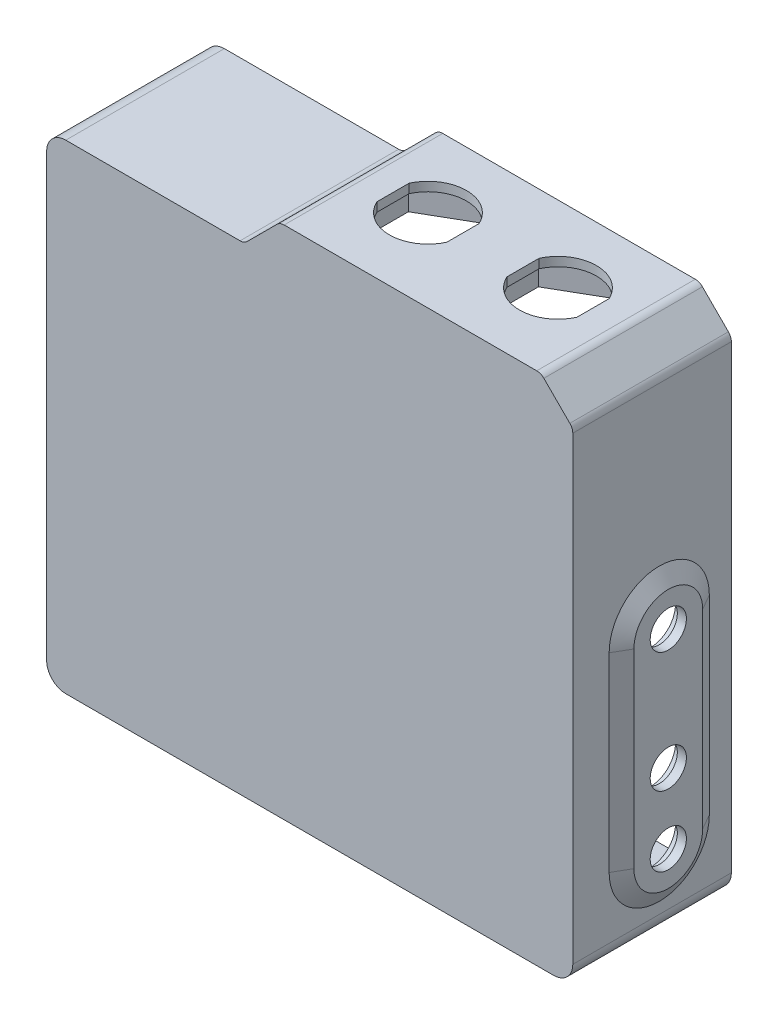
from build123d import *
from OCP.BRepFilletAPI import BRepFilletAPI_MakeChamfer

# Parameters (mm, degrees)
BOSS_EXTRUDE1_DEPTH     = 1.5
BOSS_EXTRUDE2_START     = -1.5
BOSS_EXTRUDE2_DEPTH     = 1.5
FILLET1_R               = 2
BOSS_EXTRUDE3_DEPTH     = 30
SKETCH5_R               = 5.032
SKETCH5_R_2             = 4.832
CUT_EXTRUDE1_DEPTH      = 10
BOSS_EXTRUDE4_START     = 1.8
SKETCH6_R               = 5.032
SKETCH6_R_2             = 3.597
BOSS_EXTRUDE4_DEPTH     = 1.8
CHAMFER1_SIZE           = 3.117691454
CHAMFER1_SIZE_2         = 1.8
CUT_EXTRUDE2_DEPTH      = 11.8
BOSS_EXTRUDE5_OUTLINE_W = 50.173145751
BOSS_EXTRUDE5_OUTLINE_H = 30
BOSS_EXTRUDE5_DEPTH     = 5.3
BOSS_EXTRUDE6_START     = -30
BOSS_EXTRUDE6_DEPTH     = 30
FILLET2_R               = 2
SKETCH10_R              = 2.85
SKETCH10_R_2            = 1.5
BOSS_EXTRUDE7_DEPTH     = 9
CHAMFER2_SIZE           = 2
SKETCH11_R              = 2.85
SKETCH11_R_2            = 1.5
BOSS_EXTRUDE8_DEPTH     = 30
FILLET3_R               = 2


# Read off the part's stored shape, not the designer's step: Boss-Extrude5
# Some blends are built 0.0001 mm under size
with BuildPart() as part:
    # Sketch1 → Boss-Extrude1 (new body)
    with BuildSketch(Plane.XY):
        with BuildLine():
            Line((-71.515147012, 38.673979945), (-31.595147012, 38.673979945))
            Line((-31.595147012, 38.673979945), (25.404852988, 38.673979945))
            ThreePointArc((25.404852988, 38.673979945), (28.091858756, 37.560985714), (29.204852988, 34.873979945))
            Line((29.204852988, 34.873979945), (29.204852988, -31.776020055))
            Line((29.204852988, -31.776020055), (29.204852988, -46.156020055))
            Line((29.204852988, -46.156020055), (29.204852988, -52.766020055))
            ThreePointArc((29.204852988, -52.766020055), (28.091858756, -55.453025824), (25.404852988, -56.566020055))
            Line((25.404852988, -56.566020055), (-31.595147012, -56.566020055))
            Line((-31.595147012, -56.566020055), (-71.515147012, -56.566020055))
            ThreePointArc((-71.515147012, -56.566020055), (-74.202152781, -55.453025824), (-75.315147012, -52.766020055))
            Line((-75.315147012, -52.766020055), (-75.315147012, 34.873979945))
            ThreePointArc((-75.315147012, 34.873979945), (-74.202152781, 37.560985714), (-71.515147012, 38.673979945))
        make_face()
    extrude(amount=BOSS_EXTRUDE1_DEPTH)

    # Sketch2 → Boss-Extrude2 (add)
    with BuildSketch(Plane.XY.offset(1.5).offset(BOSS_EXTRUDE2_START)):
        Polygon((-24.958369356, 43.973979945), (-22.708369356, 43.973979945), (-22.708369356, 45.773979945), (-24.958369356, 45.773979945), (-28.958369356, 45.773979945), (-36.058369356, 38.673979945), (-24.958369356, 38.673979945), (-24.958369356, 41.673979945), align=None)
        Polygon((-22.708369356, 45.773979945), (-22.708369356, 43.973979945), (-24.958369356, 43.973979945), (-24.958369356, 41.673979945), (-24.958369356, 38.673979945), (-6.958369356, 38.673979945), (-6.958369356, 41.673979945), (-6.958369356, 43.973979945), (-9.208369356, 43.973979945), (-9.208369356, 45.773979945), align=None)
        Polygon((-6.958369356, 45.773979945), (-9.208369356, 45.773979945), (-9.208369356, 43.973979945), (-6.958369356, 43.973979945), (-6.958369356, 41.673979945), (-6.958369356, 38.673979945), (0.871630644, 38.673979945), (0.871630644, 41.673979945), (0.871630644, 43.973979945), (3.121630644, 43.973979945), (3.121630644, 45.773979945), (0.871630644, 45.773979945), align=None)
        Polygon((16.621630644, 45.773979945), (3.121630644, 45.773979945), (3.121630644, 43.973979945), (0.871630644, 43.973979945), (0.871630644, 41.673979945), (0.871630644, 38.673979945), (18.871630644, 38.673979945), (18.871630644, 41.673979945), (18.871630644, 43.973979945), (16.621630644, 43.973979945), align=None)
        with BuildLine():
            Line((18.871630644, 45.773979945), (16.621630644, 45.773979945))
            Line((16.621630644, 45.773979945), (16.621630644, 43.973979945))
            Line((16.621630644, 43.973979945), (18.871630644, 43.973979945))
            Line((18.871630644, 43.973979945), (18.871630644, 41.673979945))
            Line((18.871630644, 41.673979945), (18.871630644, 38.673979945))
            Line((18.871630644, 38.673979945), (25.404852988, 38.673979945))
            ThreePointArc((25.404852988, 38.673979945), (28.091858756, 37.560985714), (29.204852988, 34.873979945))
            Line((29.204852988, 34.873979945), (29.204852988, 39.440757601))
            Line((29.204852988, 39.440757601), (22.871630644, 45.773979945))
            Line((22.871630644, 45.773979945), (18.871630644, 45.773979945))
        make_face()
    extrude(amount=BOSS_EXTRUDE2_DEPTH)

    # Fillet1
    fillet1_edges = [part.edges().sort_by_distance(p)[0] for p in [
        (-36.058369356, 38.673979945, 0.75),
        (-28.958369356, 45.773979945, 0.75),
        (22.871630644, 45.773979945, 0.75),
        (29.204852988, 39.440757601, 0.75),
    ]]
    fillet(fillet1_edges, radius=FILLET1_R)

    # Sketch3 → Boss-Extrude3 (add)
    with BuildSketch(Plane(origin=(0, 0, 0), x_dir=(-1, 0, 0), z_dir=(0, 0, -1))):
        with BuildLine():
            Line((-29.204852988, 38.612330476), (-29.204852988, -52.766020055))
            ThreePointArc((-29.204852988, -52.766020055), (-28.091858756, -55.453025824), (-25.404852988, -56.566020055))
            Line((-25.404852988, -56.566020055), (71.515147012, -56.566020055))
            ThreePointArc((71.515147012, -56.566020055), (74.202152781, -55.453025824), (75.315147012, -52.766020055))
            Line((75.315147012, -52.766020055), (75.315147012, 34.873979945))
            ThreePointArc((75.315147012, 34.873979945), (74.202152781, 37.560985714), (71.515147012, 38.673979945))
            Line((71.515147012, 38.673979945), (36.886796481, 38.673979945))
            ThreePointArc((36.886796481, 38.673979945), (36.121429616, 38.82622088), (35.472582919, 39.259766383))
            Line((35.472582919, 39.259766383), (29.544155794, 45.188193507))
            ThreePointArc((29.544155794, 45.188193507), (28.895309096, 45.62173901), (28.129942232, 45.773979945))
            Line((28.129942232, 45.773979945), (-22.043203519, 45.773979945))
            ThreePointArc((-22.043203519, 45.773979945), (-22.808570384, 45.62173901), (-23.457417081, 45.188193507))
            Line((-23.457417081, 45.188193507), (-28.61906655, 40.026544038))
            ThreePointArc((-28.61906655, 40.026544038), (-29.052612053, 39.377697341), (-29.204852988, 38.612330476))
        make_face()
        with BuildLine():
            Line((-25.404852988, -54.766020055), (71.515147012, -54.766020055))
            ThreePointArc((71.515147012, -54.766020055), (72.929360575, -54.180233617), (73.515147012, -52.766020055))
            Line((73.515147012, -52.766020055), (73.515147012, 34.873979945))
            ThreePointArc((73.515147012, 34.873979945), (72.929360575, 36.288193507), (71.515147012, 36.873979945))
            Line((71.515147012, 36.873979945), (36.886796481, 36.873979945))
            ThreePointArc((36.886796481, 36.873979945), (35.432599438, 37.163237721), (34.199790713, 37.986974176))
            Line((34.199790713, 37.986974176), (28.271363588, 43.915401301))
            ThreePointArc((28.271363588, 43.915401301), (28.206478918, 43.958755851), (28.129942232, 43.973979945))
            Line((28.129942232, 43.973979945), (-22.043203519, 43.973979945))
            ThreePointArc((-22.043203519, 43.973979945), (-22.119740205, 43.958755851), (-22.184624875, 43.915401301))
            Line((-22.184624875, 43.915401301), (-27.346274344, 38.753751832))
            ThreePointArc((-27.346274344, 38.753751832), (-27.389628894, 38.688867163), (-27.404852988, 38.612330476))
            Line((-27.404852988, 38.612330476), (-27.404852988, -52.766020055))
            ThreePointArc((-27.404852988, -52.766020055), (-26.81906655, -54.180233617), (-25.404852988, -54.766020055))
        make_face(mode=Mode.SUBTRACT)
    extrude(amount=BOSS_EXTRUDE3_DEPTH)

    # Sketch5 → Cut-Extrude1 (cut)
    # profile 1 of 6: a face of its own
    with BuildSketch(Plane(origin=(29.204852988, 0, 0), x_dir=(0, 0, -1), z_dir=(1, 0, 0))):
        with Locations(Location((15.675, -40.576020055, 0), (0, 0, 90))):
            Circle(SKETCH5_R)
        with Locations((15.675, -40.576020055)):
            Circle(SKETCH5_R_2, mode=Mode.SUBTRACT)
    # profile 2 of 6: a face of its own
    with BuildSketch(Plane(origin=(29.204852988, 0, 0), x_dir=(0, 0, -1), z_dir=(1, 0, 0))):
        with Locations((15.675, -40.576020055)):
            Circle(SKETCH5_R_2)
    # profile 3 of 6: a face of its own
    with BuildSketch(Plane(origin=(29.204852988, 0, 0), x_dir=(0, 0, -1), z_dir=(1, 0, 0))):
        with Locations(Location((15.675, -26.676020055, 0), (0, 0, 90))):
            Circle(SKETCH5_R)
        with Locations((15.675, -26.676020055)):
            Circle(SKETCH5_R_2, mode=Mode.SUBTRACT)
    # profile 4 of 6: a face of its own
    with BuildSketch(Plane(origin=(29.204852988, 0, 0), x_dir=(0, 0, -1), z_dir=(1, 0, 0))):
        with Locations((15.675, -26.676020055)):
            Circle(SKETCH5_R_2)
    # profile 5 of 6: a face of its own
    with BuildSketch(Plane(origin=(29.204852988, 0, 0), x_dir=(0, 0, -1), z_dir=(1, 0, 0))):
        with Locations(Location((15.675, -2.776020055, 0), (0, 0, 90))):
            Circle(SKETCH5_R)
        with Locations((15.675, -2.776020055)):
            Circle(SKETCH5_R_2, mode=Mode.SUBTRACT)
    # profile 6 of 6: a face of its own
    with BuildSketch(Plane(origin=(29.204852988, 0, 0), x_dir=(0, 0, -1), z_dir=(1, 0, 0))):
        with Locations((15.675, -2.776020055)):
            Circle(SKETCH5_R_2)
    extrude(amount=-CUT_EXTRUDE1_DEPTH, mode=Mode.SUBTRACT)

    # Sketch6 → Boss-Extrude4 (add)
    # profile 1 of 4: a face of its own
    with BuildSketch(Plane(origin=(29.204852988, 0, 0), x_dir=(0, 0, -1), z_dir=(1, 0, 0)).offset(BOSS_EXTRUDE4_START)):
        with BuildLine():
            Line((8.843, -40.576020055), (8.843, -2.776020055))
            ThreePointArc((8.843, -2.776020055), (15.675, 4.055979945), (22.507, -2.776020055))
            Line((22.507, -2.776020055), (22.507, -40.576020055))
            ThreePointArc((22.507, -40.576020055), (15.675, -47.408020055), (8.843, -40.576020055))
        make_face()
        with Locations(Location((15.675, -26.676020055, 0), (0, 0, 90))):
            Circle(SKETCH6_R, mode=Mode.SUBTRACT)
        with Locations(Location((15.675, -40.576020055, 0), (0, 0, 90))):
            Circle(SKETCH6_R, mode=Mode.SUBTRACT)
        with Locations(Location((15.675, -2.776020055, 0), (0, 0, 90))):
            Circle(SKETCH6_R, mode=Mode.SUBTRACT)
    # profile 2 of 4: a face of its own
    with BuildSketch(Plane(origin=(29.204852988, 0, 0), x_dir=(0, 0, -1), z_dir=(1, 0, 0)).offset(BOSS_EXTRUDE4_START)):
        with Locations(Location((15.675, -40.576020055, 0), (0, 0, 90))):
            Circle(SKETCH6_R)
        with Locations(Location((15.675, -40.576020055, 0), (0, 0, 90))):
            Circle(SKETCH6_R_2, mode=Mode.SUBTRACT)
    # profile 3 of 4: a face of its own
    with BuildSketch(Plane(origin=(29.204852988, 0, 0), x_dir=(0, 0, -1), z_dir=(1, 0, 0)).offset(BOSS_EXTRUDE4_START)):
        with Locations(Location((15.675, -2.776020055, 0), (0, 0, 90))):
            Circle(SKETCH6_R)
        with Locations(Location((15.675, -2.776020055, 0), (0, 0, 90))):
            Circle(SKETCH6_R_2, mode=Mode.SUBTRACT)
    # profile 4 of 4: a face of its own
    with BuildSketch(Plane(origin=(29.204852988, 0, 0), x_dir=(0, 0, -1), z_dir=(1, 0, 0)).offset(BOSS_EXTRUDE4_START)):
        with Locations(Location((15.675, -26.676020055, 0), (0, 0, 90))):
            Circle(SKETCH6_R)
        with Locations(Location((15.675, -26.676020055, 0), (0, 0, 90))):
            Circle(SKETCH6_R_2, mode=Mode.SUBTRACT)
    extrude(amount=-BOSS_EXTRUDE4_DEPTH)

    # Chamfer1
    chamfer1_edges_1 = [part.edges().sort_by_distance(p)[0] for p in [
        (29.204852988, -21.676020055, -8.843),
    ]]
    chamfer1_side_1 = [part.faces().sort_by_distance(p)[0] for p in [
        (29.204852988, -21.676020055, -8.807),
    ]]
    chamfer1_edges_2 = [part.edges().sort_by_distance(p)[0] for p in [
        (29.204852988, -47.408020055, -15.675),
    ]]
    chamfer1_side_2 = [part.faces().sort_by_distance(p)[0] for p in [
        (29.204852988, -47.444020055, -15.675),
    ]]
    chamfer1_edges_3 = [part.edges().sort_by_distance(p)[0] for p in [
        (29.204852988, 4.055979945, -15.675),
    ]]
    chamfer1_side_3 = [part.faces().sort_by_distance(p)[0] for p in [
        (29.204852988, 4.091979945, -15.675),
    ]]
    chamfer1_edges_4 = [part.edges().sort_by_distance(p)[0] for p in [
        (29.204852988, -21.676020055, -22.507),
    ]]
    chamfer1_side_4 = [part.faces().sort_by_distance(p)[0] for p in [
        (29.204852988, -21.676020055, -22.543),
    ]]
    chamfer1 = BRepFilletAPI_MakeChamfer(part.part.solid().wrapped)
    for e in chamfer1_edges_1:
        chamfer1.Add(CHAMFER1_SIZE - 0.0001, CHAMFER1_SIZE_2 - 0.0001, e.wrapped, chamfer1_side_1[0].wrapped)
    for e in chamfer1_edges_2:
        chamfer1.Add(CHAMFER1_SIZE - 0.0001, CHAMFER1_SIZE_2 - 0.0001, e.wrapped, chamfer1_side_2[0].wrapped)
    for e in chamfer1_edges_3:
        chamfer1.Add(CHAMFER1_SIZE - 0.0001, CHAMFER1_SIZE_2 - 0.0001, e.wrapped, chamfer1_side_3[0].wrapped)
    for e in chamfer1_edges_4:
        chamfer1.Add(CHAMFER1_SIZE - 0.0001, CHAMFER1_SIZE_2 - 0.0001, e.wrapped, chamfer1_side_4[0].wrapped)
    add(Compound.cast(chamfer1.Shape()), mode=Mode.REPLACE)  # a hair under: the kernel refuses the full size

    # Sketch7 → Cut-Extrude2 (cut)
    # profile 1 of 4: a face of its own
    with BuildSketch(Plane(origin=(0, 45.773979945, 0), x_dir=(1, 0, 0), z_dir=(0, 1, 0))):
        with BuildLine():
            Line((-22.908369356, 14.892304845), (-22.908369356, 11.695431373))
            ThreePointArc((-22.908369356, 11.695431373), (-15.958369356, 7.242304845), (-9.008369356, 11.695431373))
            Line((-9.008369356, 11.695431373), (-9.008369356, 14.892304845))
            Line((-9.008369356, 14.892304845), (-9.008369356, 18.089178318))
            ThreePointArc((-9.008369356, 18.089178318), (-15.958369356, 22.542304845), (-22.908369356, 18.089178318))
            Line((-22.908369356, 18.089178318), (-22.908369356, 14.892304845))
        make_face()
        with BuildLine():
            ThreePointArc((-9.208369356, 18.0450814), (-15.958369356, 22.342304845), (-22.708369356, 18.0450814))
            Line((-22.708369356, 18.0450814), (-22.708369356, 14.892304845))
            Line((-22.708369356, 14.892304845), (-22.708369356, 11.739528291))
            ThreePointArc((-22.708369356, 11.739528291), (-15.958369356, 7.442304845), (-9.208369356, 11.739528291))
            Line((-9.208369356, 11.739528291), (-9.208369356, 14.892304845))
            Line((-9.208369356, 14.892304845), (-9.208369356, 18.0450814))
        make_face(mode=Mode.SUBTRACT)
    # profile 2 of 4: a face of its own
    with BuildSketch(Plane(origin=(0, 45.773979945, 0), x_dir=(1, 0, 0), z_dir=(0, 1, 0))):
        with BuildLine():
            Line((-9.208369356, 14.892304845), (-9.208369356, 18.0450814))
            ThreePointArc((-9.208369356, 18.0450814), (-15.958369356, 22.342304845), (-22.708369356, 18.0450814))
            Line((-22.708369356, 18.0450814), (-22.708369356, 14.892304845))
            Line((-22.708369356, 14.892304845), (-22.708369356, 11.739528291))
            ThreePointArc((-22.708369356, 11.739528291), (-15.958369356, 7.442304845), (-9.208369356, 11.739528291))
            Line((-9.208369356, 11.739528291), (-9.208369356, 14.892304845))
        make_face()
    # profile 3 of 4: a face of its own
    with BuildSketch(Plane(origin=(0, 45.773979945, 0), x_dir=(1, 0, 0), z_dir=(0, 1, 0))):
        with BuildLine():
            Line((2.921630644, 14.892304845), (2.921630644, 11.695431373))
            ThreePointArc((2.921630644, 11.695431373), (9.871630644, 7.242304845), (16.821630644, 11.695431373))
            Line((16.821630644, 11.695431373), (16.821630644, 14.892304845))
            Line((16.821630644, 14.892304845), (16.821630644, 18.089178318))
            ThreePointArc((16.821630644, 18.089178318), (9.871630644, 22.542304845), (2.921630644, 18.089178318))
            Line((2.921630644, 18.089178318), (2.921630644, 14.892304845))
        make_face()
        with BuildLine():
            ThreePointArc((16.621630644, 18.0450814), (9.871630644, 22.342304845), (3.121630644, 18.0450814))
            Line((3.121630644, 18.0450814), (3.121630644, 14.892304845))
            Line((3.121630644, 14.892304845), (3.121630644, 11.739528291))
            ThreePointArc((3.121630644, 11.739528291), (9.871630644, 7.442304845), (16.621630644, 11.739528291))
            Line((16.621630644, 11.739528291), (16.621630644, 14.892304845))
            Line((16.621630644, 14.892304845), (16.621630644, 18.0450814))
        make_face(mode=Mode.SUBTRACT)
    # profile 4 of 4: a face of its own
    with BuildSketch(Plane(origin=(0, 45.773979945, 0), x_dir=(1, 0, 0), z_dir=(0, 1, 0))):
        with BuildLine():
            Line((16.621630644, 14.892304845), (16.621630644, 18.0450814))
            ThreePointArc((16.621630644, 18.0450814), (9.871630644, 22.342304845), (3.121630644, 18.0450814))
            Line((3.121630644, 18.0450814), (3.121630644, 14.892304845))
            Line((3.121630644, 14.892304845), (3.121630644, 11.739528291))
            ThreePointArc((3.121630644, 11.739528291), (9.871630644, 7.442304845), (16.621630644, 11.739528291))
            Line((16.621630644, 11.739528291), (16.621630644, 14.892304845))
        make_face()
    extrude(amount=-CUT_EXTRUDE2_DEPTH, mode=Mode.SUBTRACT)

    # Boss-Extrude5 outline → Boss-Extrude5 (add)
    with BuildSketch(Plane.XZ.offset(-43.973979945)):
        with Locations((-3.043369356, -15)):
            Rectangle(BOSS_EXTRUDE5_OUTLINE_W, BOSS_EXTRUDE5_OUTLINE_H)
        Polygon((-6.758369356, -9.580682369), (-6.758369356, -20.203927322), (-15.958369356, -25.515549799), (-25.158369356, -20.203927322), (-25.158369356, -9.580682369), (-15.958369356, -4.269059892), align=None, mode=Mode.SUBTRACT)
        Polygon((19.071630644, -20.203927322), (9.871630644, -25.515549799), (0.671630644, -20.203927322), (0.671630644, -9.580682369), (9.871630644, -4.269059892), (19.071630644, -9.580682369), align=None, mode=Mode.SUBTRACT)
    extrude(amount=BOSS_EXTRUDE5_DEPTH)

    # Sketch9 → Boss-Extrude6 (add)
    with BuildSketch(Plane(origin=(0, 0, -30), x_dir=(-1, 0, 0), z_dir=(0, 0, -1)).offset(BOSS_EXTRUDE6_START)):
        with BuildLine():
            Line((-27.395114237, 38.673979945), (-22.043203519, 38.673979945))
            Line((-22.043203519, 38.673979945), (-22.043203519, 43.973979945))
            ThreePointArc((-22.043203519, 43.973979945), (-22.119740205, 43.958755851), (-22.184624875, 43.915401301))
            Line((-22.184624875, 43.915401301), (-27.346274344, 38.753751832))
            ThreePointArc((-27.346274344, 38.753751832), (-27.375423285, 38.716761189), (-27.395114237, 38.673979945))
        make_face()
        with BuildLine():
            Line((33.512784944, 38.673979945), (28.271363588, 43.915401301))
            ThreePointArc((28.271363588, 43.915401301), (28.206478918, 43.958755851), (28.129942232, 43.973979945))
            Line((28.129942232, 43.973979945), (28.129942232, 38.673979945))
            Line((28.129942232, 38.673979945), (33.512784944, 38.673979945))
        make_face()
    extrude(amount=BOSS_EXTRUDE6_DEPTH)

    # Fillet2
    fillet2_edges = [part.edges().sort_by_distance(p)[0] for p in [
        (-33.512784944, 38.673979945, -15),
        (27.395114237, 38.673979945, -15),
    ]]
    fillet(fillet2_edges, radius=FILLET2_R)

    # Sketch10 → Boss-Extrude7 (add)
    # profile 1 of 18: a face of its own
    with BuildSketch(Plane(origin=(0, 0, 0), x_dir=(-1, 0, 0), z_dir=(0, 0, -1))):
        with Locations((-18.794852988, 15.423979945)):
            Circle(SKETCH10_R)
        with Locations(Location((-18.794852988, 15.423979945, 0), (0, 0, 270))):
            Circle(SKETCH10_R_2, mode=Mode.SUBTRACT)
    # profile 2 of 18: a face of its own
    with BuildSketch(Plane(origin=(0, 0, 0), x_dir=(-1, 0, 0), z_dir=(0, 0, -1))):
        with Locations((25.985147012, 15.423979945)):
            Circle(SKETCH10_R)
        with Locations(Location((25.985147012, 15.423979945, 0), (0, 0, 270))):
            Circle(SKETCH10_R_2, mode=Mode.SUBTRACT)
    # profile 3 of 18: a face of its own
    with BuildSketch(Plane(origin=(0, 0, 0), x_dir=(-1, 0, 0), z_dir=(0, 0, -1))):
        with Locations((25.985147012, 1.043979945)):
            Circle(SKETCH10_R)
        with Locations(Location((25.985147012, 1.043979945, 0), (0, 0, 270))):
            Circle(SKETCH10_R_2, mode=Mode.SUBTRACT)
    # profile 4 of 18: a face of its own
    with BuildSketch(Plane(origin=(0, 0, 0), x_dir=(-1, 0, 0), z_dir=(0, 0, -1))):
        with Locations((-18.794852988, 1.043979945)):
            Circle(SKETCH10_R)
        with Locations(Location((-18.794852988, 1.043979945, 0), (0, 0, 270))):
            Circle(SKETCH10_R_2, mode=Mode.SUBTRACT)
    # profile 5 of 18: a face of its own
    with BuildSketch(Plane(origin=(0, 0, 0), x_dir=(-1, 0, 0), z_dir=(0, 0, -1))):
        with Locations((-18.794852988, -8.176020055)):
            Circle(SKETCH10_R)
        with Locations((-18.794852988, -8.176020055)):
            Circle(SKETCH10_R_2, mode=Mode.SUBTRACT)
    # profile 6 of 18: a face of its own
    with BuildSketch(Plane(origin=(0, 0, 0), x_dir=(-1, 0, 0), z_dir=(0, 0, -1))):
        with Locations((25.985147012, -8.176020055)):
            Circle(SKETCH10_R)
        with Locations((25.985147012, -8.176020055)):
            Circle(SKETCH10_R_2, mode=Mode.SUBTRACT)
    # profile 7 of 18: a face of its own
    with BuildSketch(Plane(origin=(0, 0, 0), x_dir=(-1, 0, 0), z_dir=(0, 0, -1))):
        with Locations((25.985147012, -22.556020055)):
            Circle(SKETCH10_R)
        with Locations((25.985147012, -22.556020055)):
            Circle(SKETCH10_R_2, mode=Mode.SUBTRACT)
    # profile 8 of 18: a face of its own
    with BuildSketch(Plane(origin=(0, 0, 0), x_dir=(-1, 0, 0), z_dir=(0, 0, -1))):
        with Locations((-18.794852988, -22.556020055)):
            Circle(SKETCH10_R)
        with Locations((-18.794852988, -22.556020055)):
            Circle(SKETCH10_R_2, mode=Mode.SUBTRACT)
    # profile 9 of 18: a face of its own
    with BuildSketch(Plane(origin=(0, 0, 0), x_dir=(-1, 0, 0), z_dir=(0, 0, -1))):
        with Locations((-18.794852988, -31.776020055)):
            Circle(SKETCH10_R)
        with Locations((-18.794852988, -31.776020055)):
            Circle(SKETCH10_R_2, mode=Mode.SUBTRACT)
    # profile 10 of 18: a face of its own
    with BuildSketch(Plane(origin=(0, 0, 0), x_dir=(-1, 0, 0), z_dir=(0, 0, -1))):
        with Locations((25.985147012, -31.776020055)):
            Circle(SKETCH10_R)
        with Locations((25.985147012, -31.776020055)):
            Circle(SKETCH10_R_2, mode=Mode.SUBTRACT)
    # profile 11 of 18: a face of its own
    with BuildSketch(Plane(origin=(0, 0, 0), x_dir=(-1, 0, 0), z_dir=(0, 0, -1))):
        with Locations((25.985147012, -46.156020055)):
            Circle(SKETCH10_R)
        with Locations((25.985147012, -46.156020055)):
            Circle(SKETCH10_R_2, mode=Mode.SUBTRACT)
    # profile 12 of 18: a face of its own
    with BuildSketch(Plane(origin=(0, 0, 0), x_dir=(-1, 0, 0), z_dir=(0, 0, -1))):
        with Locations((-18.794852988, -46.156020055)):
            Circle(SKETCH10_R)
        with Locations((-18.794852988, -46.156020055)):
            Circle(SKETCH10_R_2, mode=Mode.SUBTRACT)
    # profile 13 of 18: a face of its own
    with BuildSketch(Plane(origin=(0, 0, 0), x_dir=(-1, 0, 0), z_dir=(0, 0, -1))):
        with Locations((35.645147012, -3.706020055)):
            Circle(SKETCH10_R)
        with Locations((35.645147012, -3.706020055)):
            Circle(SKETCH10_R_2, mode=Mode.SUBTRACT)
    # profile 14 of 18: a face of its own
    with BuildSketch(Plane(origin=(0, 0, 0), x_dir=(-1, 0, 0), z_dir=(0, 0, -1))):
        with Locations((35.645147012, 24.173979945)):
            Circle(SKETCH10_R)
        with Locations((35.645147012, 24.173979945)):
            Circle(SKETCH10_R_2, mode=Mode.SUBTRACT)
    # profile 15 of 18: a face of its own
    with BuildSketch(Plane(origin=(0, 0, 0), x_dir=(-1, 0, 0), z_dir=(0, 0, -1))):
        with Locations((65.015147012, 9.643979945)):
            Circle(SKETCH10_R)
        with Locations((65.015147012, 9.643979945)):
            Circle(SKETCH10_R_2, mode=Mode.SUBTRACT)
    # profile 16 of 18: a face of its own
    with BuildSketch(Plane(origin=(0, 0, 0), x_dir=(-1, 0, 0), z_dir=(0, 0, -1))):
        with Locations((65.015147012, -18.236020055)):
            Circle(SKETCH10_R)
        with Locations((65.015147012, -18.236020055)):
            Circle(SKETCH10_R_2, mode=Mode.SUBTRACT)
    # profile 17 of 18: a face of its own
    with BuildSketch(Plane(origin=(0, 0, 0), x_dir=(-1, 0, 0), z_dir=(0, 0, -1))):
        with Locations((35.645147012, -31.586020055)):
            Circle(SKETCH10_R)
        with Locations((35.645147012, -31.586020055)):
            Circle(SKETCH10_R_2, mode=Mode.SUBTRACT)
    # profile 18 of 18: a face of its own
    with BuildSketch(Plane(origin=(0, 0, 0), x_dir=(-1, 0, 0), z_dir=(0, 0, -1))):
        with Locations((65.015147012, -46.116020055)):
            Circle(SKETCH10_R)
        with Locations((65.015147012, -46.116020055)):
            Circle(SKETCH10_R_2, mode=Mode.SUBTRACT)
    extrude(amount=BOSS_EXTRUDE7_DEPTH)

    # Chamfer2
    # the kernel refuses this chamfer: 2 mm, written as the material it adds along each edge
    with BuildSketch(Plane(origin=(18.794852988, 15.423979945, 0), x_dir=(-1, 0, 0), z_dir=(0, -1, 0))) as chamfer2_piece_1:
        Polygon((2.85 + CHAMFER2_SIZE, 0), (2.85, CHAMFER2_SIZE), (2.85, 0), align=None)
    revolve(axis=Axis((18.794852988, 15.423979945, 0), (0, 0, -1)))
    with BuildSketch(Plane(origin=(-25.985147012, 15.423979945, 0), x_dir=(-1, 0, 0), z_dir=(0, -1, 0))) as chamfer2_piece_2:
        Polygon((2.85 + CHAMFER2_SIZE, 0), (2.85, CHAMFER2_SIZE), (2.85, 0), align=None)
    revolve(axis=Axis((-25.985147012, 15.423979945, 0), (0, 0, -1)))
    with BuildSketch(Plane(origin=(-25.985147012, 1.043979945, 0), x_dir=(-1, 0, 0), z_dir=(0, -1, 0))) as chamfer2_piece_3:
        Polygon((2.85 + CHAMFER2_SIZE, 0), (2.85, CHAMFER2_SIZE), (2.85, 0), align=None)
    revolve(axis=Axis((-25.985147012, 1.043979945, 0), (0, 0, -1)))
    with BuildSketch(Plane(origin=(18.794852988, 1.043979945, 0), x_dir=(-1, 0, 0), z_dir=(0, -1, 0))) as chamfer2_piece_4:
        Polygon((2.85 + CHAMFER2_SIZE, 0), (2.85, CHAMFER2_SIZE), (2.85, 0), align=None)
    revolve(axis=Axis((18.794852988, 1.043979945, 0), (0, 0, -1)))
    with BuildSketch(Plane(origin=(18.794852988, -8.176020055, 0), x_dir=(-1, 0, 0), z_dir=(0, -1, 0))) as chamfer2_piece_5:
        Polygon((2.85 + CHAMFER2_SIZE, 0), (2.85, CHAMFER2_SIZE), (2.85, 0), align=None)
    revolve(axis=Axis((18.794852988, -8.176020055, 0), (0, 0, -1)))
    with BuildSketch(Plane(origin=(-25.985147012, -8.176020055, 0), x_dir=(-1, 0, 0), z_dir=(0, -1, 0))) as chamfer2_piece_6:
        Polygon((2.85 + CHAMFER2_SIZE, 0), (2.85, CHAMFER2_SIZE), (2.85, 0), align=None)
    revolve(axis=Axis((-25.985147012, -8.176020055, 0), (0, 0, -1)))
    with BuildSketch(Plane(origin=(-25.985147012, -22.556020055, 0), x_dir=(-1, 0, 0), z_dir=(0, -1, 0))) as chamfer2_piece_7:
        Polygon((2.85 + CHAMFER2_SIZE, 0), (2.85, CHAMFER2_SIZE), (2.85, 0), align=None)
    revolve(axis=Axis((-25.985147012, -22.556020055, 0), (0, 0, -1)))
    with BuildSketch(Plane(origin=(18.794852988, -22.556020055, 0), x_dir=(-1, 0, 0), z_dir=(0, -1, 0))) as chamfer2_piece_8:
        Polygon((2.85 + CHAMFER2_SIZE, 0), (2.85, CHAMFER2_SIZE), (2.85, 0), align=None)
    revolve(axis=Axis((18.794852988, -22.556020055, 0), (0, 0, -1)))
    with BuildSketch(Plane(origin=(18.794852988, -31.776020055, 0), x_dir=(-1, 0, 0), z_dir=(0, -1, 0))) as chamfer2_piece_9:
        Polygon((2.85 + CHAMFER2_SIZE, 0), (2.85, CHAMFER2_SIZE), (2.85, 0), align=None)
    revolve(axis=Axis((18.794852988, -31.776020055, 0), (0, 0, -1)))
    with BuildSketch(Plane(origin=(-25.985147012, -31.776020055, 0), x_dir=(-1, 0, 0), z_dir=(0, -1, 0))) as chamfer2_piece_10:
        Polygon((2.85 + CHAMFER2_SIZE, 0), (2.85, CHAMFER2_SIZE), (2.85, 0), align=None)
    revolve(axis=Axis((-25.985147012, -31.776020055, 0), (0, 0, -1)))
    with BuildSketch(Plane(origin=(-25.985147012, -46.156020055, 0), x_dir=(-1, 0, 0), z_dir=(0, -1, 0))) as chamfer2_piece_11:
        Polygon((2.85 + CHAMFER2_SIZE, 0), (2.85, CHAMFER2_SIZE), (2.85, 0), align=None)
    revolve(axis=Axis((-25.985147012, -46.156020055, 0), (0, 0, -1)))
    with BuildSketch(Plane(origin=(18.794852988, -46.156020055, 0), x_dir=(-1, 0, 0), z_dir=(0, -1, 0))) as chamfer2_piece_12:
        Polygon((2.85 + CHAMFER2_SIZE, 0), (2.85, CHAMFER2_SIZE), (2.85, 0), align=None)
    revolve(axis=Axis((18.794852988, -46.156020055, 0), (0, 0, -1)))
    with BuildSketch(Plane(origin=(-35.645147012, -3.706020055, 0), x_dir=(-1, 0, 0), z_dir=(0, -1, 0))) as chamfer2_piece_13:
        Polygon((2.85 + CHAMFER2_SIZE, 0), (2.85, CHAMFER2_SIZE), (2.85, 0), align=None)
    revolve(axis=Axis((-35.645147012, -3.706020055, 0), (0, 0, -1)))
    with BuildSketch(Plane(origin=(-35.645147012, 24.173979945, 0), x_dir=(-1, 0, 0), z_dir=(0, -1, 0))) as chamfer2_piece_14:
        Polygon((2.85 + CHAMFER2_SIZE, 0), (2.85, CHAMFER2_SIZE), (2.85, 0), align=None)
    revolve(axis=Axis((-35.645147012, 24.173979945, 0), (0, 0, -1)))
    with BuildSketch(Plane(origin=(-65.015147012, 9.643979945, 0), x_dir=(-1, 0, 0), z_dir=(0, -1, 0))) as chamfer2_piece_15:
        Polygon((2.85 + CHAMFER2_SIZE, 0), (2.85, CHAMFER2_SIZE), (2.85, 0), align=None)
    revolve(axis=Axis((-65.015147012, 9.643979945, 0), (0, 0, -1)))
    with BuildSketch(Plane(origin=(-65.015147012, -18.236020055, 0), x_dir=(-1, 0, 0), z_dir=(0, -1, 0))) as chamfer2_piece_16:
        Polygon((2.85 + CHAMFER2_SIZE, 0), (2.85, CHAMFER2_SIZE), (2.85, 0), align=None)
    revolve(axis=Axis((-65.015147012, -18.236020055, 0), (0, 0, -1)))
    with BuildSketch(Plane(origin=(-35.645147012, -31.586020055, 0), x_dir=(-1, 0, 0), z_dir=(0, -1, 0))) as chamfer2_piece_17:
        Polygon((2.85 + CHAMFER2_SIZE, 0), (2.85, CHAMFER2_SIZE), (2.85, 0), align=None)
    revolve(axis=Axis((-35.645147012, -31.586020055, 0), (0, 0, -1)))
    with BuildSketch(Plane(origin=(-65.015147012, -46.116020055, 0), x_dir=(-1, 0, 0), z_dir=(0, -1, 0))) as chamfer2_piece_18:
        Polygon((2.85 + CHAMFER2_SIZE, 0), (2.85, CHAMFER2_SIZE), (2.85, 0), align=None)
    revolve(axis=Axis((-65.015147012, -46.116020055, 0), (0, 0, -1)))

    # Sketch11 → Boss-Extrude8 (add)
    # profile 1 of 8: a face of its own
    with BuildSketch(Plane(origin=(0, 0, 0), x_dir=(-1, 0, 0), z_dir=(0, 0, -1))):
        with Locations((-25.404852988, 36.673979945)):
            Circle(SKETCH11_R)
        with Locations((-25.404852988, 36.673979945)):
            Circle(SKETCH11_R_2, mode=Mode.SUBTRACT)
    # profile 2 of 8: a face of its own
    with BuildSketch(Plane(origin=(0, 0, 0), x_dir=(-1, 0, 0), z_dir=(0, 0, -1))):
        with Locations((32.684357819, 36.673979945)):
            Circle(SKETCH11_R)
        with Locations((32.684357819, 36.673979945)):
            Circle(SKETCH11_R_2, mode=Mode.SUBTRACT)
    # profile 3 of 8: a face of its own
    with BuildSketch(Plane(origin=(0, 0, 0), x_dir=(-1, 0, 0), z_dir=(0, 0, -1))):
        with Locations((71.515147012, 34.873979945)):
            Circle(SKETCH11_R)
        with Locations((71.515147012, 34.873979945)):
            Circle(SKETCH11_R_2, mode=Mode.SUBTRACT)
    # profile 4 of 8: a face of its own
    with BuildSketch(Plane(origin=(0, 0, 0), x_dir=(-1, 0, 0), z_dir=(0, 0, -1))):
        with Locations((71.515147012, -8.946020055)):
            Circle(SKETCH11_R)
        with Locations((71.515147012, -8.946020055)):
            Circle(SKETCH11_R_2, mode=Mode.SUBTRACT)
    # profile 5 of 8: a face of its own
    with BuildSketch(Plane(origin=(0, 0, 0), x_dir=(-1, 0, 0), z_dir=(0, 0, -1))):
        with Locations((71.515147012, -52.766020055)):
            Circle(SKETCH11_R)
        with Locations((71.515147012, -52.766020055)):
            Circle(SKETCH11_R_2, mode=Mode.SUBTRACT)
    # profile 6 of 8: a face of its own
    with BuildSketch(Plane(origin=(0, 0, 0), x_dir=(-1, 0, 0), z_dir=(0, 0, -1))):
        with Locations((23.055147012, -52.766020055)):
            Circle(SKETCH11_R)
        with Locations((23.055147012, -52.766020055)):
            Circle(SKETCH11_R_2, mode=Mode.SUBTRACT)
    # profile 7 of 8: a face of its own
    with BuildSketch(Plane(origin=(0, 0, 0), x_dir=(-1, 0, 0), z_dir=(0, 0, -1))):
        with Locations((-25.404852988, -52.766020055)):
            Circle(SKETCH11_R)
        with Locations((-25.404852988, -52.766020055)):
            Circle(SKETCH11_R_2, mode=Mode.SUBTRACT)
    # profile 8 of 8: a face of its own
    with BuildSketch(Plane(origin=(0, 0, 0), x_dir=(-1, 0, 0), z_dir=(0, 0, -1))):
        with Locations((-25.404852988, -15.884660039)):
            Circle(SKETCH11_R)
        with Locations((-25.404852988, -15.884660039)):
            Circle(SKETCH11_R_2, mode=Mode.SUBTRACT)
    extrude(amount=BOSS_EXTRUDE8_DEPTH)

    # Fillet3
    fillet3_edges = [part.edges().sort_by_distance(p)[0] for p in [
        (-35.496415588, 37.137478712, -15),
        (-30.653963769, 38.673979945, -15),
        (-69.484752962, 36.873979945, -15),
        (-73.515147012, 32.843585895, -15),
        (-73.515147012, -10.976414105, -15),
        (-73.515147012, -6.915626005, -15),
        (-73.515147012, -50.735626005, -15),
        (-69.484752962, -54.766020055, -15),
        (-25.085541063, -54.766020055, -15),
        (-21.024752962, -54.766020055, -15),
        (27.404852988, -50.735626005, -15),
        (23.374458937, -54.766020055, -15),
        (27.404852988, -17.91505409, -15),
        (27.404852988, -13.854265989, -15),
        (27.404852988, 34.643585895, -15),
        (23.374458937, 38.673979945, -15),
    ]]
    fillet(fillet3_edges, radius=FILLET3_R)


solid = part.part
